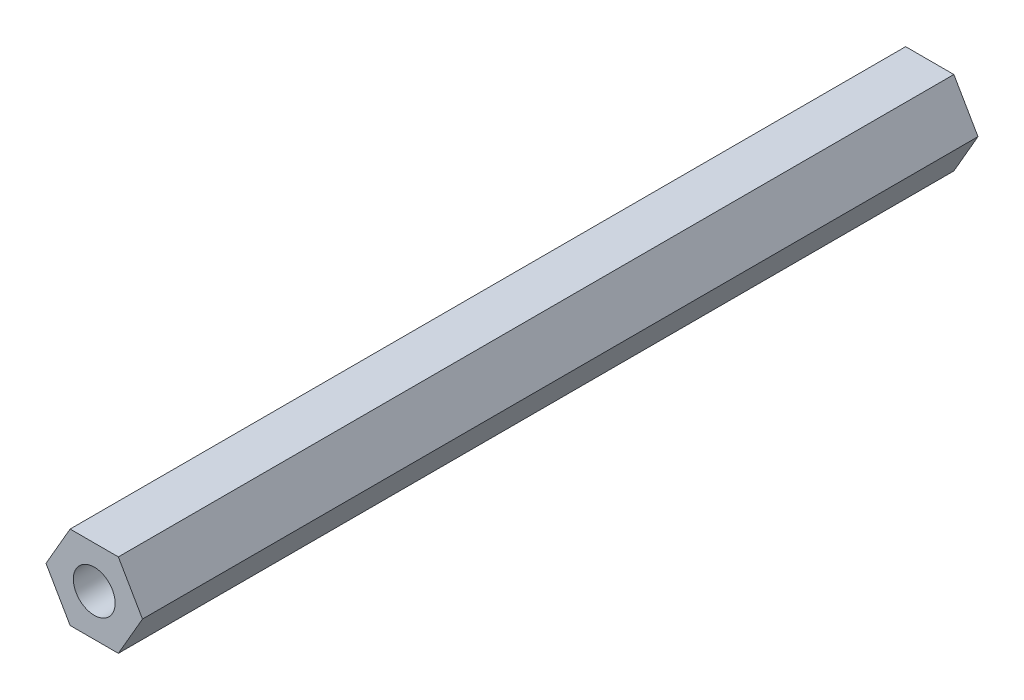
from build123d import *

# Parameters (mm, degrees)
SKETCH1_R           = 3.175
BOSS_EXTRUDE1_DEPTH = 63.5


with BuildPart() as part:
    # Sketch1 → Boss-Extrude1 (new, symmetric)
    with BuildSketch(Plane.XY):
        Polygon((3.666174209, 6.35), (-3.666174209, 6.35), (-7.332348419, 0), (-3.666174209, -6.35), (3.666174209, -6.35), (7.332348419, 0), align=None)
        Circle(SKETCH1_R, mode=Mode.SUBTRACT)
    extrude(amount=BOSS_EXTRUDE1_DEPTH, both=True)


solid = part.part
